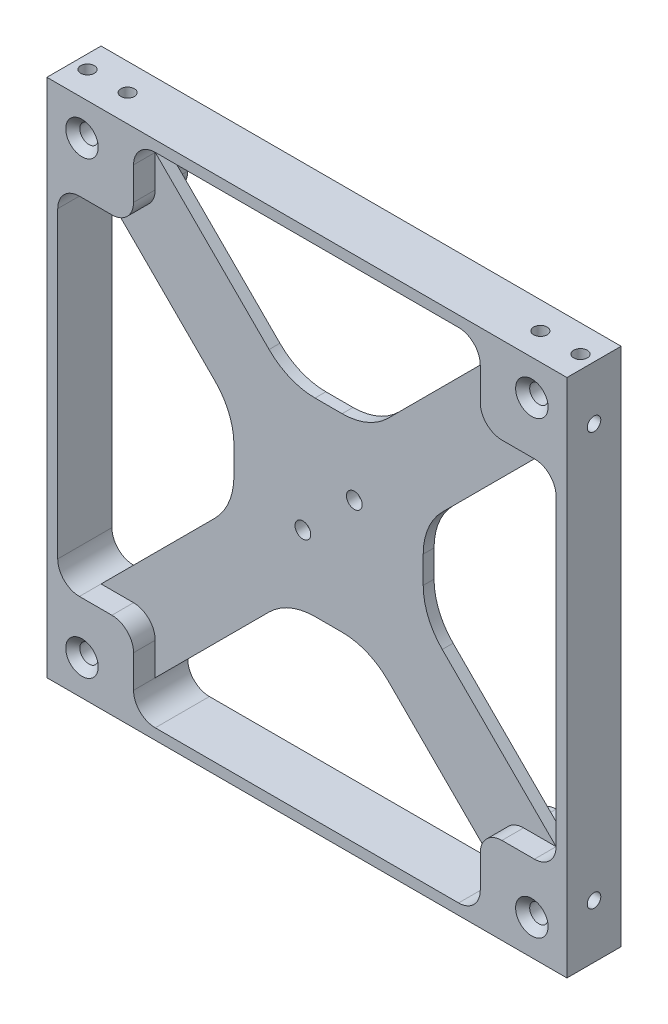
from build123d import *

# Parameters (mm, degrees)
BOTTOMLAYER_DEPTH              = 4
MIDDLELAYER_DEPTH              = 2
FILLUPLAYER_START              = -2
FILLUPLAYER_DEPTH              = 2
TOPLAYER_DEPTH                 = 4
M3_CLEARANCE_HOLE1_D           = 3.4
M3_CLEARANCE_HOLE1_CSINK_D     = 6
M3_CLEARANCE_HOLE1_CSINK_ANGLE = 90
M2_5_CLEARANCE_HOLE1_D         = 2.9
CIRPATTERN1_COUNT              = 4
SKETCH30_R                     = 2.7
CUT_EXTRUDE1_DEPTH             = 3.4
CIRPATTERN2_COUNT              = 4


with BuildPart() as part:
    # Sketch3 → BottomLayer (new body)
    with BuildSketch(Plane.XY):
        with BuildLine():
            Line((0, 48), (48, 48))
            Line((48, 48), (48, 0))
            Line((48, 0), (46, 0))
            Line((46, 0), (46, 28))
            ThreePointArc((46, 28), (44.828427125, 30.828427125), (42, 32))
            Line((42, 32), (36, 32))
            ThreePointArc((36, 32), (33.171572875, 33.171572875), (32, 36))
            Line((32, 36), (32, 42))
            ThreePointArc((32, 42), (30.828427125, 44.828427125), (28, 46))
            Line((28, 46), (0, 46))
            Line((0, 46), (0, 48))
        make_face()
    bottomlayer = extrude(amount=BOTTOMLAYER_DEPTH)

    # Sketch6 → MiddleLayer (add)
    with BuildSketch(Plane.XY.offset(4)):
        with BuildLine():
            Line((0, 17.470562748), (0, 0))
            Line((0, 0), (17.470562748, 0))
            Line((17.470562748, 0), (17.470562748, 2.5))
            ThreePointArc((17.470562748, 2.5), (18.384008358, 7.092201188), (20.985281374, 10.985281374))
            Line((20.985281374, 10.985281374), (48, 38))
            Line((48, 38), (48, 48))
            Line((48, 48), (38, 48))
            Line((38, 48), (10.985281374, 20.985281374))
            ThreePointArc((10.985281374, 20.985281374), (7.092201188, 18.384008358), (2.5, 17.470562748))
            Line((2.5, 17.470562748), (0, 17.470562748))
        make_face()
    middlelayer = extrude(amount=MIDDLELAYER_DEPTH)

    # Sketch10 → FillUpLayer (add)
    with BuildSketch(Plane.XY.offset(6).offset(FILLUPLAYER_START)):
        with BuildLine():
            Line((48, 48), (0, 48))
            Line((0, 48), (0, 46))
            Line((0, 46), (28, 46))
            ThreePointArc((28, 46), (30.828427125, 44.828427125), (32, 42))
            Line((32, 42), (32, 36))
            ThreePointArc((32, 36), (33.171572875, 33.171572875), (36, 32))
            Line((36, 32), (42, 32))
            ThreePointArc((42, 32), (44.828427125, 30.828427125), (46, 28))
            Line((46, 28), (46, 0))
            Line((46, 0), (48, 0))
            Line((48, 0), (48, 48))
        make_face()
    filluplayer = extrude(amount=FILLUPLAYER_DEPTH)

    # Sketch11 → TopLayer (add)
    with BuildSketch(Plane.XY.offset(6)):
        with BuildLine():
            Line((48, 48), (0, 48))
            Line((0, 48), (0, 46))
            Line((0, 46), (28, 46))
            ThreePointArc((28, 46), (30.828427125, 44.828427125), (32, 42))
            Line((32, 42), (32, 36))
            ThreePointArc((32, 36), (33.171572875, 33.171572875), (36, 32))
            Line((36, 32), (42, 32))
            ThreePointArc((42, 32), (44.828427125, 30.828427125), (46, 28))
            Line((46, 28), (46, 0))
            Line((46, 0), (48, 0))
            Line((48, 0), (48, 48))
        make_face()
    toplayer = extrude(amount=TOPLAYER_DEPTH)

    # M3 Clearance Hole1 (through all)
    with Locations(Plane.XY.offset(10)):
        with Locations((41.525, 41.525)):
            m3_clearance_hole1 = CounterSinkHole(M3_CLEARANCE_HOLE1_D / 2, M3_CLEARANCE_HOLE1_CSINK_D / 2, counter_sink_angle=M3_CLEARANCE_HOLE1_CSINK_ANGLE)

    # M2.5 Clearance Hole1 (through all)
    with Locations(Plane.XY.offset(6)):
        with Locations((4.75, 4.75)):
            m2_5_clearance_hole1 = Hole(M2_5_CLEARANCE_HOLE1_D / 2)

    # CirPattern1: BottomLayer, MiddleLayer, FillUpLayer, TopLayer, M3 Clearance Hole1 ×4 about axis
    cirpattern1_axis = Axis((0, 0, -0.5), (0, 0, 1))
    add([bottomlayer.rotate(cirpattern1_axis, i * 360 / CIRPATTERN1_COUNT) for i in range(1, CIRPATTERN1_COUNT)])
    add([middlelayer.rotate(cirpattern1_axis, i * 360 / CIRPATTERN1_COUNT) for i in range(1, CIRPATTERN1_COUNT)])
    add([filluplayer.rotate(cirpattern1_axis, i * 360 / CIRPATTERN1_COUNT) for i in range(1, CIRPATTERN1_COUNT)])
    add([toplayer.rotate(cirpattern1_axis, i * 360 / CIRPATTERN1_COUNT) for i in range(1, CIRPATTERN1_COUNT)])
    add([m3_clearance_hole1.rotate(cirpattern1_axis, i * 360 / CIRPATTERN1_COUNT) for i in range(1, CIRPATTERN1_COUNT)], mode=Mode.SUBTRACT)

    # Sketch21 → Tap Drill M3 Side Plate (revolve, cut)
    with BuildSketch(Plane(origin=(48, 38.1, 5), x_dir=(0, 0, -1), z_dir=(0, 1, 0))):
        Polygon((0, 0), (0, 5.751075774), (1.25, 5), (1.25, 0), align=None)
    tap_drill_m3_side_plate = revolve(axis=Axis((54.35, 38.1, 5), (-1, 0, 0)), mode=Mode.SUBTRACT)

    # Camera Holes: M2.5 Clearance Hole1 across plane
    add(m2_5_clearance_hole1.mirror(Plane(origin=(0, 0, 0), x_dir=(0, 0, 1), z_dir=(-0.7071067811865476, -0.7071067811865476, 0))), mode=Mode.SUBTRACT)

    # Sketch27 → Tap Drill M3 Side Plate 2 (revolve, cut)
    with BuildSketch(Plane(origin=(38.1, 48, 5), x_dir=(0, 0, 1), z_dir=(1, 0, 0))):
        Polygon((0, 0), (0, 5.751075774), (1.25, 5), (1.25, 0), align=None)
    tap_drill_m3_side_plate_2 = revolve(axis=Axis((38.1, 54.35, 5), (0, -1, 0)), mode=Mode.SUBTRACT)

    # Sketch29 → Tap Drill M3 Rail (revolve, cut)
    with BuildSketch(Plane(origin=(45.5, 48, 5), x_dir=(0, 0, 1), z_dir=(1, 0, 0))):
        Polygon((0, 0), (0, 5.751075774), (1.25, 5), (1.25, 0), align=None)
    tap_drill_m3_rail = revolve(axis=Axis((45.5, 54.35, 5), (0, -1, 0)), mode=Mode.SUBTRACT)

    # SidePlate and Rail Holes 1: Tap Drill M3 Side Plate, Tap Drill M3 Side Plate 2, Tap Drill M3 Rail across plane
    add(tap_drill_m3_side_plate.mirror(Plane(origin=(0, 0, 0), x_dir=(0, 0, 1), z_dir=(1, 0, 0))), mode=Mode.SUBTRACT)
    add(tap_drill_m3_side_plate_2.mirror(Plane(origin=(0, 0, 0), x_dir=(0, 0, 1), z_dir=(1, 0, 0))), mode=Mode.SUBTRACT)
    add(tap_drill_m3_rail.mirror(Plane(origin=(0, 0, 0), x_dir=(0, 0, 1), z_dir=(1, 0, 0))), mode=Mode.SUBTRACT)

    # Side Plate and Rail Holes 2 copy 1 sketc → Side Plate and Rail Holes 2 copy 1 (revolve, cut)
    with BuildSketch(Plane(origin=(-48, -38.1, 5), x_dir=(0, 0, -1), z_dir=(0, -1, 0))):
        Polygon((0, 0), (0, 5.751075774), (1.25, 5), (1.25, 0), align=None)
    revolve(axis=Axis((-54.35, -38.1, 5), (1, 0, 0)), mode=Mode.SUBTRACT)

    # Side Plate and Rail Holes 2 copy 2 sketc → Side Plate and Rail Holes 2 copy 2 (revolve, cut)
    with BuildSketch(Plane(origin=(-38.1, -48, 5), x_dir=(0, 0, 1), z_dir=(-1, 0, 0))):
        Polygon((0, 0), (0, 5.751075774), (1.25, 5), (1.25, 0), align=None)
    revolve(axis=Axis((-38.1, -54.35, 5), (0, 1, 0)), mode=Mode.SUBTRACT)

    # Side Plate and Rail Holes 2 copy 3 sketc → Side Plate and Rail Holes 2 copy 3 (revolve, cut)
    with BuildSketch(Plane(origin=(-45.5, -48, 5), x_dir=(0, 0, 1), z_dir=(-1, 0, 0))):
        Polygon((0, 0), (0, 5.751075774), (1.25, 5), (1.25, 0), align=None)
    revolve(axis=Axis((-45.5, -54.35, 5), (0, 1, 0)), mode=Mode.SUBTRACT)

    # Side Plate and Rail Holes 2 copy 4 sketc → Side Plate and Rail Holes 2 copy 4 (revolve, cut)
    with BuildSketch(Plane(origin=(48, -38.1, 5), x_dir=(0, 0, -1), z_dir=(0, -1, 0))):
        Polygon((0, 0), (0, -5.751075774), (1.25, -5), (1.25, 0), align=None)
    revolve(axis=Axis((54.35, -38.1, 5), (1, 0, 0)), mode=Mode.SUBTRACT)

    # Side Plate and Rail Holes 2 copy 5 sketc → Side Plate and Rail Holes 2 copy 5 (revolve, cut)
    with BuildSketch(Plane(origin=(38.1, -48, 5), x_dir=(0, 0, 1), z_dir=(1, 0, 0))):
        Polygon((0, 0), (0, -5.751075774), (1.25, -5), (1.25, 0), align=None)
    revolve(axis=Axis((38.1, -54.35, 5), (0, -1, 0)), mode=Mode.SUBTRACT)

    # Side Plate and Rail Holes 2 copy 6 sketc → Side Plate and Rail Holes 2 copy 6 (revolve, cut)
    with BuildSketch(Plane(origin=(45.5, -48, 5), x_dir=(0, 0, 1), z_dir=(1, 0, 0))):
        Polygon((0, 0), (0, -5.751075774), (1.25, -5), (1.25, 0), align=None)
    revolve(axis=Axis((45.5, -54.35, 5), (0, -1, 0)), mode=Mode.SUBTRACT)

    # Sketch30 → Cut-Extrude1 (cut)
    with BuildSketch(Plane(origin=(0, 0, 0), x_dir=(-1, 0, 0), z_dir=(0, 0, -1))):
        with Locations((-41.525, 41.525)):
            Circle(SKETCH30_R)
    cut_extrude1 = extrude(amount=-CUT_EXTRUDE1_DEPTH, mode=Mode.SUBTRACT)

    # CirPattern2: Cut-Extrude1 ×4 about axis
    cirpattern2_axis = Axis((0, 0, -0.5), (0, 0, 1))
    for i in range(1, CIRPATTERN2_COUNT):
        add(cut_extrude1.rotate(cirpattern2_axis, i * 360 / CIRPATTERN2_COUNT), mode=Mode.SUBTRACT)


solid = part.part
